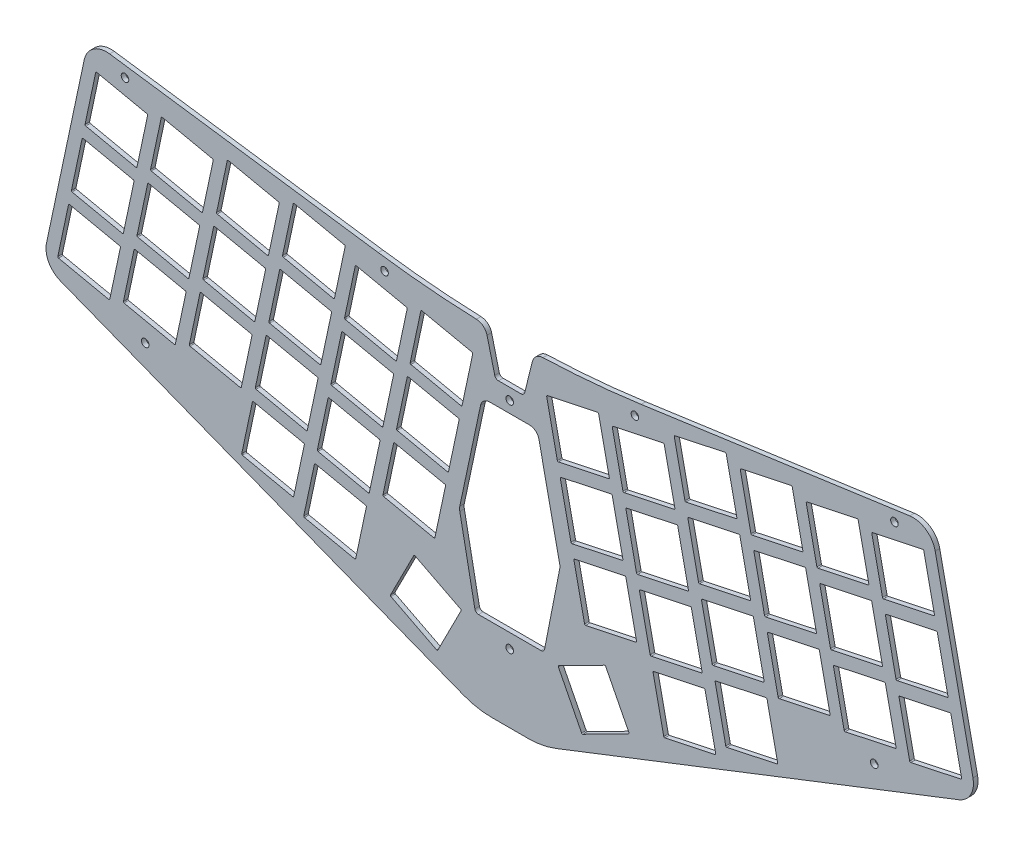
from build123d import *

# Parameters (mm, degrees)
MODEL_R             = 1
BOSS_EXTRUDE1_DEPTH = 1.2


with BuildPart() as part:
    # Model → Boss-Extrude1 (new body)
    with BuildSketch(Plane.XY):
        with BuildLine():
            ThreePointArc((119.338629114, -36.3417418), (123.033383047, -35.997499058), (126.600947758, -34.976621137))
            Line((126.600947758, -34.976621137), (232.915297986, 6.455827865))
            ThreePointArc((232.915297986, 6.455827865), (236.0167753, 9.19676994), (236.605487998, 13.293761806))
            Line((236.605487998, 13.293761806), (226.655780482, 60.103455566))
            ThreePointArc((226.655780482, 60.103455566), (224.228353496, 63.77089769), (219.95185627, 64.797593838))
            Line((219.95185627, 64.797593838), (149.130188739, 54.844257568))
            ThreePointArc((149.130188739, 54.844257568), (136.222632248, 53.372447422), (123.255880075, 52.575843528))
            ThreePointArc((123.255880075, 52.575843528), (121.473278822, 51.908806158), (120.45077354, 50.303474719))
            Line((120.45077354, 50.303474719), (118.425135625, 42.179084789))
            ThreePointArc((118.425135625, 42.179084789), (118.070501374, 41.632995931), (117.454839898, 41.421006685))
            Line((117.454839898, 41.421006685), (111.497333302, 41.421006685))
            ThreePointArc((111.497333302, 41.421006685), (110.881671826, 41.632995931), (110.527037575, 42.179084789))
            Line((110.527037575, 42.179084789), (108.50139966, 50.303474719))
            ThreePointArc((108.50139966, 50.303474719), (107.478894378, 51.908806158), (105.696293125, 52.575843528))
            ThreePointArc((105.696293125, 52.575843528), (92.729540952, 53.372447422), (79.821984461, 54.844257568))
            Line((79.821984461, 54.844257568), (9.00031693, 64.797593838))
            ThreePointArc((9.00031693, 64.797593838), (4.723819704, 63.77089769), (2.296392718, 60.103455566))
            Line((2.296392718, 60.103455566), (-7.653314798, 13.293761806))
            ThreePointArc((-7.653314798, 13.293761806), (-7.0646021, 9.19676994), (-3.963124786, 6.455827865))
            Line((-3.963124786, 6.455827865), (102.351225442, -34.976621137))
            ThreePointArc((102.351225442, -34.976621137), (105.918790153, -35.997499058), (109.613544086, -36.3417418))
            Line((109.613544086, -36.3417418), (119.338629114, -36.3417418))
        make_face()
        with BuildLine():
            Line((89.509984524, -9.560584668), (101.538572624, -15.689456368))
            ThreePointArc((101.538572624, -15.689456368), (101.662839129, -15.83495375), (101.647826632, -16.025705624))
            Line((101.647826632, -16.025705624), (95.518954932, -28.054293724))
            ThreePointArc((95.518954932, -28.054293724), (95.37345755, -28.178560229), (95.182705676, -28.163547732))
            Line((95.182705676, -28.163547732), (83.154117576, -22.034676032))
            ThreePointArc((83.154117576, -22.034676032), (83.029851071, -21.88917865), (83.044863568, -21.698426776))
            Line((83.044863568, -21.698426776), (89.173735268, -9.669838676))
            ThreePointArc((89.173735268, -9.669838676), (89.31923265, -9.545572171), (89.509984524, -9.560584668))
        make_face(mode=Mode.SUBTRACT)
        with BuildLine():
            Line((46.927405722, 4.338040313), (60.132398335, 1.5312325))
            ThreePointArc((60.132398335, 1.5312325), (60.290088055, 1.422855359), (60.324957313, 1.234717678))
            Line((60.324957313, 1.234717678), (57.5181495, -11.970274935))
            ThreePointArc((57.5181495, -11.970274935), (57.409772359, -12.127964655), (57.221634678, -12.162833913))
            Line((57.221634678, -12.162833913), (44.016642065, -9.3560261))
            ThreePointArc((44.016642065, -9.3560261), (43.858952345, -9.247648959), (43.824083087, -9.059511278))
            Line((43.824083087, -9.059511278), (46.6308909, 4.145481335))
            ThreePointArc((46.6308909, 4.145481335), (46.739268041, 4.303171055), (46.927405722, 4.338040313))
        make_face(mode=Mode.SUBTRACT)
        with Locations((18.380405922, 3.505093389)):
            Circle(MODEL_R, mode=Mode.SUBTRACT)
        with BuildLine():
            ThreePointArc((46.326049635, 19.5453863), (46.483739355, 19.437009159), (46.518608613, 19.248871478))
            Line((46.518608613, 19.248871478), (43.7118008, 6.043878865))
            ThreePointArc((43.7118008, 6.043878865), (43.603423659, 5.886189145), (43.415285978, 5.851319887))
            Line((43.415285978, 5.851319887), (30.210293365, 8.6581277))
            ThreePointArc((30.210293365, 8.6581277), (30.052603645, 8.766504841), (30.017734387, 8.954642522))
            Line((30.017734387, 8.954642522), (32.8245422, 22.159635135))
            ThreePointArc((32.8245422, 22.159635135), (32.932919341, 22.317324855), (33.121057022, 22.352194113))
            Line((33.121057022, 22.352194113), (46.326049635, 19.5453863))
        make_face(mode=Mode.SUBTRACT)
        with BuildLine():
            Line((63.280672622, -1.693805387), (76.485665235, -4.5006132))
            ThreePointArc((76.485665235, -4.5006132), (76.643354955, -4.608990341), (76.678224213, -4.797128022))
            Line((76.678224213, -4.797128022), (73.8714164, -18.002120635))
            ThreePointArc((73.8714164, -18.002120635), (73.763039259, -18.159810355), (73.574901578, -18.194679613))
            Line((73.574901578, -18.194679613), (60.369908965, -15.3878718))
            ThreePointArc((60.369908965, -15.3878718), (60.212219245, -15.279494659), (60.177349987, -15.091356978))
            Line((60.177349987, -15.091356978), (62.9841578, -1.886364365))
            ThreePointArc((62.9841578, -1.886364365), (63.092534941, -1.728674645), (63.280672622, -1.693805387))
        make_face(mode=Mode.SUBTRACT)
        with BuildLine():
            Line((66.867149222, 15.179240713), (80.072141835, 12.3724329))
            ThreePointArc((80.072141835, 12.3724329), (80.229831555, 12.264055759), (80.264700813, 12.075918078))
            Line((80.264700813, 12.075918078), (77.457893, -1.129074535))
            ThreePointArc((77.457893, -1.129074535), (77.349515859, -1.286764255), (77.161378178, -1.321633513))
            Line((77.161378178, -1.321633513), (63.956385565, 1.4851743))
            ThreePointArc((63.956385565, 1.4851743), (63.798695845, 1.593551441), (63.763826587, 1.781689122))
            Line((63.763826587, 1.781689122), (66.5706344, 14.986681735))
            ThreePointArc((66.5706344, 14.986681735), (66.679011541, 15.144371455), (66.867149222, 15.179240713))
        make_face(mode=Mode.SUBTRACT)
        with BuildLine():
            Line((50.513882322, 21.211086413), (63.718874935, 18.4042786))
            ThreePointArc((63.718874935, 18.4042786), (63.876564655, 18.295901459), (63.911433913, 18.107763778))
            Line((63.911433913, 18.107763778), (61.1046261, 4.902771165))
            ThreePointArc((61.1046261, 4.902771165), (60.996248959, 4.745081445), (60.808111278, 4.710212187))
            Line((60.808111278, 4.710212187), (47.603118665, 7.51702))
            ThreePointArc((47.603118665, 7.51702), (47.445428945, 7.625397141), (47.410559687, 7.813534822))
            Line((47.410559687, 7.813534822), (50.2173675, 21.018527435))
            ThreePointArc((50.2173675, 21.018527435), (50.325744641, 21.176217155), (50.513882322, 21.211086413))
        make_face(mode=Mode.SUBTRACT)
        with BuildLine():
            Line((84.156018722, 13.549059313), (97.361011335, 10.7422515))
            ThreePointArc((97.361011335, 10.7422515), (97.518701055, 10.633874359), (97.553570313, 10.445736678))
            Line((97.553570313, 10.445736678), (94.7467625, -2.759255935))
            ThreePointArc((94.7467625, -2.759255935), (94.638385359, -2.916945655), (94.450247678, -2.951814913))
            Line((94.450247678, -2.951814913), (81.245255065, -0.1450071))
            ThreePointArc((81.245255065, -0.1450071), (81.087565345, -0.036629959), (81.052696087, 0.151507722))
            Line((81.052696087, 0.151507722), (83.8595039, 13.356500335))
            ThreePointArc((83.8595039, 13.356500335), (83.967881041, 13.514190055), (84.156018722, 13.549059313))
        make_face(mode=Mode.SUBTRACT)
        with BuildLine():
            Line((127.643452867, 6.515489672), (123.671373637, -13.757755399))
            ThreePointArc((123.671373637, -13.757755399), (123.325535014, -14.337582176), (122.690031867, -14.565483898))
            Line((122.690031867, -14.565483898), (106.262141333, -14.565483898))
            ThreePointArc((106.262141333, -14.565483898), (105.626638186, -14.337582176), (105.280799563, -13.757755399))
            Line((105.280799563, -13.757755399), (101.308720333, 6.515489672))
            ThreePointArc((101.308720333, 6.515489672), (101.252841202, 7.116248716), (101.318302841, 7.716039245))
            Line((101.318302841, 7.716039245), (106.786266514, 33.44078591))
            ThreePointArc((106.786266514, 33.44078591), (107.658334538, 34.863871588), (109.231635516, 35.421006685))
            Line((109.231635516, 35.421006685), (119.720537684, 35.421006685))
            ThreePointArc((119.720537684, 35.421006685), (121.293838662, 34.863871588), (122.165906686, 33.44078591))
            Line((122.165906686, 33.44078591), (127.633870359, 7.716039245))
            ThreePointArc((127.633870359, 7.716039245), (127.699331998, 7.116248716), (127.643452867, 6.515489672))
        make_face(mode=Mode.SUBTRACT)
        with Locations((114.4760866, -18.3417418)):
            Circle(MODEL_R, mode=Mode.SUBTRACT)
        with BuildLine():
            Line((127.413600576, -15.689456368), (139.442188676, -9.560584668))
            ThreePointArc((139.442188676, -9.560584668), (139.63294055, -9.545572171), (139.778437932, -9.669838676))
            Line((139.778437932, -9.669838676), (145.907309632, -21.698426776))
            ThreePointArc((145.907309632, -21.698426776), (145.922322129, -21.88917865), (145.798055624, -22.034676032))
            Line((145.798055624, -22.034676032), (133.769467524, -28.163547732))
            ThreePointArc((133.769467524, -28.163547732), (133.57871565, -28.178560229), (133.433218268, -28.054293724))
            Line((133.433218268, -28.054293724), (127.304346568, -16.025705624))
            ThreePointArc((127.304346568, -16.025705624), (127.289334071, -15.83495375), (127.413600576, -15.689456368))
        make_face(mode=Mode.SUBTRACT)
        with BuildLine():
            Line((152.466507965, -4.5006132), (165.671500578, -1.693805387))
            ThreePointArc((165.671500578, -1.693805387), (165.859638259, -1.728674645), (165.9680154, -1.886364365))
            Line((165.9680154, -1.886364365), (168.774823213, -15.091356978))
            ThreePointArc((168.774823213, -15.091356978), (168.739953955, -15.279494659), (168.582264235, -15.3878718))
            Line((168.582264235, -15.3878718), (155.377271622, -18.194679613))
            ThreePointArc((155.377271622, -18.194679613), (155.189133941, -18.159810355), (155.0807568, -18.002120635))
            Line((155.0807568, -18.002120635), (152.273948987, -4.797128022))
            ThreePointArc((152.273948987, -4.797128022), (152.308818245, -4.608990341), (152.466507965, -4.5006132))
        make_face(mode=Mode.SUBTRACT)
        with BuildLine():
            Line((131.591161865, 10.7422515), (144.796154478, 13.549059313))
            ThreePointArc((144.796154478, 13.549059313), (144.984292159, 13.514190055), (145.0926693, 13.356500335))
            Line((145.0926693, 13.356500335), (147.899477113, 0.151507722))
            ThreePointArc((147.899477113, 0.151507722), (147.864607855, -0.036629959), (147.706918135, -0.1450071))
            Line((147.706918135, -0.1450071), (134.501925522, -2.951814913))
            ThreePointArc((134.501925522, -2.951814913), (134.313787841, -2.916945655), (134.2054107, -2.759255935))
            Line((134.2054107, -2.759255935), (131.398602887, 10.445736678))
            ThreePointArc((131.398602887, 10.445736678), (131.433472145, 10.633874359), (131.591161865, 10.7422515))
        make_face(mode=Mode.SUBTRACT)
        with BuildLine():
            Line((148.880031365, 12.3724329), (162.085023978, 15.179240713))
            ThreePointArc((162.085023978, 15.179240713), (162.273161659, 15.144371455), (162.3815388, 14.986681735))
            Line((162.3815388, 14.986681735), (165.188346613, 1.781689122))
            ThreePointArc((165.188346613, 1.781689122), (165.153477355, 1.593551441), (164.995787635, 1.4851743))
            Line((164.995787635, 1.4851743), (151.790795022, -1.321633513))
            ThreePointArc((151.790795022, -1.321633513), (151.602657341, -1.286764255), (151.4942802, -1.129074535))
            Line((151.4942802, -1.129074535), (148.687472387, 12.075918078))
            ThreePointArc((148.687472387, 12.075918078), (148.722341645, 12.264055759), (148.880031365, 12.3724329))
        make_face(mode=Mode.SUBTRACT)
        with BuildLine():
            Line((165.233298265, 18.4042786), (178.438290878, 21.211086413))
            ThreePointArc((178.438290878, 21.211086413), (178.626428559, 21.176217155), (178.7348057, 21.018527435))
            Line((178.7348057, 21.018527435), (181.541613513, 7.813534822))
            ThreePointArc((181.541613513, 7.813534822), (181.506744255, 7.625397141), (181.349054535, 7.51702))
            Line((181.349054535, 7.51702), (168.144061922, 4.710212187))
            ThreePointArc((168.144061922, 4.710212187), (167.955924241, 4.745081445), (167.8475471, 4.902771165))
            Line((167.8475471, 4.902771165), (165.040739287, 18.107763778))
            ThreePointArc((165.040739287, 18.107763778), (165.075608545, 18.295901459), (165.233298265, 18.4042786))
        make_face(mode=Mode.SUBTRACT)
        with BuildLine():
            Line((168.819774865, 1.5312325), (182.024767478, 4.338040313))
            ThreePointArc((182.024767478, 4.338040313), (182.212905159, 4.303171055), (182.3212823, 4.145481335))
            Line((182.3212823, 4.145481335), (185.128090113, -9.059511278))
            ThreePointArc((185.128090113, -9.059511278), (185.093220855, -9.247648959), (184.935531135, -9.3560261))
            Line((184.935531135, -9.3560261), (171.730538522, -12.162833913))
            ThreePointArc((171.730538522, -12.162833913), (171.542400841, -12.127964655), (171.4340237, -11.970274935))
            Line((171.4340237, -11.970274935), (168.627215887, 1.234717678))
            ThreePointArc((168.627215887, 1.234717678), (168.662085145, 1.422855359), (168.819774865, 1.5312325))
        make_face(mode=Mode.SUBTRACT)
        with BuildLine():
            Line((182.626123565, 19.5453863), (195.831116178, 22.352194113))
            ThreePointArc((195.831116178, 22.352194113), (196.019253859, 22.317324855), (196.127631, 22.159635135))
            Line((196.127631, 22.159635135), (198.934438813, 8.954642522))
            ThreePointArc((198.934438813, 8.954642522), (198.899569555, 8.766504841), (198.741879835, 8.6581277))
            Line((198.741879835, 8.6581277), (185.536887222, 5.851319887))
            ThreePointArc((185.536887222, 5.851319887), (185.348749541, 5.886189145), (185.2403724, 6.043878865))
            Line((185.2403724, 6.043878865), (182.433564587, 19.248871478))
            ThreePointArc((182.433564587, 19.248871478), (182.468433845, 19.437009159), (182.626123565, 19.5453863))
        make_face(mode=Mode.SUBTRACT)
        with Locations((210.571767278, 3.505093389)):
            Circle(MODEL_R, mode=Mode.SUBTRACT)
        with BuildLine():
            ThreePointArc((-4.471401435, 11.4294168), (-4.629091155, 11.537793941), (-4.663960413, 11.725931622))
            Line((-4.663960413, 11.725931622), (-1.8571526, 24.930924235))
            ThreePointArc((-1.8571526, 24.930924235), (-1.748775459, 25.088613955), (-1.560637778, 25.123483213))
            Line((-1.560637778, 25.123483213), (11.644354835, 22.3166754))
            ThreePointArc((11.644354835, 22.3166754), (11.802044555, 22.208298259), (11.836913813, 22.020160578))
            Line((11.836913813, 22.020160578), (9.030106, 8.815167965))
            ThreePointArc((9.030106, 8.815167965), (8.921728859, 8.657478245), (8.733591178, 8.622608987))
            Line((8.733591178, 8.622608987), (-4.471401435, 11.4294168))
        make_face(mode=Mode.SUBTRACT)
        with BuildLine():
            ThreePointArc((28.933224335, 20.6864939), (29.090914055, 20.578116759), (29.125783313, 20.389979078))
            Line((29.125783313, 20.389979078), (26.3189755, 7.184986465))
            ThreePointArc((26.3189755, 7.184986465), (26.210598359, 7.027296745), (26.022460678, 6.992427487))
            Line((26.022460678, 6.992427487), (12.817468065, 9.7992353))
            ThreePointArc((12.817468065, 9.7992353), (12.659778345, 9.907612441), (12.624909087, 10.095750122))
            Line((12.624909087, 10.095750122), (15.4317169, 23.300742735))
            ThreePointArc((15.4317169, 23.300742735), (15.540094041, 23.458432455), (15.728231722, 23.493301713))
            Line((15.728231722, 23.493301713), (28.933224335, 20.6864939))
        make_face(mode=Mode.SUBTRACT)
        with BuildLine():
            ThreePointArc((15.230831435, 39.1897215), (15.388521155, 39.081344359), (15.423390413, 38.893206678))
            Line((15.423390413, 38.893206678), (12.6165826, 25.688214065))
            ThreePointArc((12.6165826, 25.688214065), (12.508205459, 25.530524345), (12.320067778, 25.495655087))
            Line((12.320067778, 25.495655087), (-0.884924835, 28.3024629))
            ThreePointArc((-0.884924835, 28.3024629), (-1.042614555, 28.410840041), (-1.077483813, 28.598977722))
            Line((-1.077483813, 28.598977722), (1.729324, 41.803970335))
            ThreePointArc((1.729324, 41.803970335), (1.837701141, 41.961660055), (2.025838822, 41.996529313))
            Line((2.025838822, 41.996529313), (15.230831435, 39.1897215))
        make_face(mode=Mode.SUBTRACT)
        with BuildLine():
            ThreePointArc((32.519700935, 37.5595401), (32.677390655, 37.451162959), (32.712259913, 37.263025278))
            Line((32.712259913, 37.263025278), (29.9054521, 24.058032665))
            ThreePointArc((29.9054521, 24.058032665), (29.797074959, 23.900342945), (29.608937278, 23.865473687))
            Line((29.608937278, 23.865473687), (16.403944665, 26.6722815))
            ThreePointArc((16.403944665, 26.6722815), (16.246254945, 26.780658641), (16.211385687, 26.968796322))
            Line((16.211385687, 26.968796322), (19.0181935, 40.173788935))
            ThreePointArc((19.0181935, 40.173788935), (19.126570641, 40.331478655), (19.314708322, 40.366347913))
            Line((19.314708322, 40.366347913), (32.519700935, 37.5595401))
        make_face(mode=Mode.SUBTRACT)
        with BuildLine():
            ThreePointArc((49.912526335, 36.4184324), (50.070216055, 36.310055259), (50.105085313, 36.121917578))
            Line((50.105085313, 36.121917578), (47.2982775, 22.916924965))
            ThreePointArc((47.2982775, 22.916924965), (47.189900359, 22.759235245), (47.001762678, 22.724365987))
            Line((47.001762678, 22.724365987), (33.796770065, 25.5311738))
            ThreePointArc((33.796770065, 25.5311738), (33.639080345, 25.639550941), (33.604211087, 25.827688622))
            Line((33.604211087, 25.827688622), (36.4110189, 39.032681235))
            ThreePointArc((36.4110189, 39.032681235), (36.519396041, 39.190370955), (36.707533722, 39.225240213))
            Line((36.707533722, 39.225240213), (49.912526335, 36.4184324))
        make_face(mode=Mode.SUBTRACT)
        with BuildLine():
            Line((70.453625922, 32.052286913), (83.658618535, 29.2454791))
            ThreePointArc((83.658618535, 29.2454791), (83.816308255, 29.137101959), (83.851177513, 28.948964278))
            Line((83.851177513, 28.948964278), (81.0443697, 15.743971665))
            ThreePointArc((81.0443697, 15.743971665), (80.935992559, 15.586281945), (80.747854878, 15.551412687))
            Line((80.747854878, 15.551412687), (67.542862265, 18.3582205))
            ThreePointArc((67.542862265, 18.3582205), (67.385172545, 18.466597641), (67.350303287, 18.654735322))
            Line((67.350303287, 18.654735322), (70.1571111, 31.859727935))
            ThreePointArc((70.1571111, 31.859727935), (70.265488241, 32.017417655), (70.453625922, 32.052286913))
        make_face(mode=Mode.SUBTRACT)
        with BuildLine():
            Line((87.742495422, 30.422105413), (100.947488035, 27.6152976))
            ThreePointArc((100.947488035, 27.6152976), (101.105177755, 27.506920459), (101.140047013, 27.318782778))
            Line((101.140047013, 27.318782778), (98.3332392, 14.113790165))
            ThreePointArc((98.3332392, 14.113790165), (98.224862059, 13.956100445), (98.036724378, 13.921231187))
            Line((98.036724378, 13.921231187), (84.831731765, 16.728039))
            ThreePointArc((84.831731765, 16.728039), (84.674042045, 16.836416141), (84.639172787, 17.024553822))
            Line((84.639172787, 17.024553822), (87.4459806, 30.229546435))
            ThreePointArc((87.4459806, 30.229546435), (87.554357741, 30.387236155), (87.742495422, 30.422105413))
        make_face(mode=Mode.SUBTRACT)
        with BuildLine():
            Line((54.100359022, 38.084132513), (67.305351635, 35.2773247))
            ThreePointArc((67.305351635, 35.2773247), (67.463041355, 35.168947559), (67.497910613, 34.980809878))
            Line((67.497910613, 34.980809878), (64.6911028, 21.775817265))
            ThreePointArc((64.6911028, 21.775817265), (64.582725659, 21.618127545), (64.394587978, 21.583258287))
            Line((64.394587978, 21.583258287), (51.189595365, 24.3900661))
            ThreePointArc((51.189595365, 24.3900661), (51.031905645, 24.498443241), (50.997036387, 24.686580922))
            Line((50.997036387, 24.686580922), (53.8038442, 37.891573535))
            ThreePointArc((53.8038442, 37.891573535), (53.912221341, 38.049263255), (54.100359022, 38.084132513))
        make_face(mode=Mode.SUBTRACT)
        with BuildLine():
            Line((91.328972122, 47.295151513), (104.533964735, 44.4883437))
            ThreePointArc((104.533964735, 44.4883437), (104.691654455, 44.379966559), (104.726523713, 44.191828878))
            Line((104.726523713, 44.191828878), (101.9197159, 30.986836265))
            ThreePointArc((101.9197159, 30.986836265), (101.811338759, 30.829146545), (101.623201078, 30.794277287))
            Line((101.623201078, 30.794277287), (88.418208465, 33.6010851))
            ThreePointArc((88.418208465, 33.6010851), (88.260518745, 33.709462241), (88.225649487, 33.897599922))
            Line((88.225649487, 33.897599922), (91.0324573, 47.102592535))
            ThreePointArc((91.0324573, 47.102592535), (91.140834441, 47.260282255), (91.328972122, 47.295151513))
        make_face(mode=Mode.SUBTRACT)
        with BuildLine():
            ThreePointArc((2.701551865, 45.175509), (2.543862145, 45.283886141), (2.508992887, 45.472023822))
            Line((2.508992887, 45.472023822), (5.3158007, 58.677016435))
            ThreePointArc((5.3158007, 58.677016435), (5.424177841, 58.834706155), (5.612315522, 58.869575413))
            Line((5.612315522, 58.869575413), (18.817308135, 56.0627676))
            ThreePointArc((18.817308135, 56.0627676), (18.974997855, 55.954390459), (19.009867113, 55.766252778))
            Line((19.009867113, 55.766252778), (16.2030593, 42.561260165))
            ThreePointArc((16.2030593, 42.561260165), (16.094682159, 42.403570445), (15.906544478, 42.368701187))
            Line((15.906544478, 42.368701187), (2.701551865, 45.175509))
        make_face(mode=Mode.SUBTRACT)
        with BuildLine():
            ThreePointArc((19.990421365, 43.5453276), (19.832731645, 43.653704741), (19.797862387, 43.841842422))
            Line((19.797862387, 43.841842422), (22.6046702, 57.046835035))
            ThreePointArc((22.6046702, 57.046835035), (22.713047341, 57.204524755), (22.901185022, 57.239394013))
            Line((22.901185022, 57.239394013), (36.106177635, 54.4325862))
            ThreePointArc((36.106177635, 54.4325862), (36.263867355, 54.324209059), (36.298736613, 54.136071378))
            Line((36.298736613, 54.136071378), (33.4919288, 40.931078765))
            ThreePointArc((33.4919288, 40.931078765), (33.383551659, 40.773389045), (33.195413978, 40.738519787))
            Line((33.195413978, 40.738519787), (19.990421365, 43.5453276))
        make_face(mode=Mode.SUBTRACT)
        with BuildLine():
            ThreePointArc((53.499002935, 53.2914785), (53.656692655, 53.183101359), (53.691561913, 52.994963678))
            Line((53.691561913, 52.994963678), (50.8847541, 39.789971065))
            ThreePointArc((50.8847541, 39.789971065), (50.776376959, 39.632281345), (50.588239278, 39.597412087))
            Line((50.588239278, 39.597412087), (37.383246665, 42.4042199))
            ThreePointArc((37.383246665, 42.4042199), (37.225556945, 42.512597041), (37.190687687, 42.700734722))
            Line((37.190687687, 42.700734722), (39.9974955, 55.905727335))
            ThreePointArc((39.9974955, 55.905727335), (40.105872641, 56.063417055), (40.294010322, 56.098286313))
            Line((40.294010322, 56.098286313), (53.499002935, 53.2914785))
        make_face(mode=Mode.SUBTRACT)
        with Locations((13.046458588, 61.37876191)):
            Circle(MODEL_R, mode=Mode.SUBTRACT)
        with BuildLine():
            Line((74.040102622, 48.925333013), (87.245095235, 46.1185252))
            ThreePointArc((87.245095235, 46.1185252), (87.402784955, 46.010148059), (87.437654213, 45.822010378))
            Line((87.437654213, 45.822010378), (84.6308464, 32.617017765))
            ThreePointArc((84.6308464, 32.617017765), (84.522469259, 32.459328045), (84.334331578, 32.424458787))
            Line((84.334331578, 32.424458787), (71.129338965, 35.2312666))
            ThreePointArc((71.129338965, 35.2312666), (70.971649245, 35.339643741), (70.936779987, 35.527781422))
            Line((70.936779987, 35.527781422), (73.7435878, 48.732774035))
            ThreePointArc((73.7435878, 48.732774035), (73.851964941, 48.890463755), (74.040102622, 48.925333013))
        make_face(mode=Mode.SUBTRACT)
        with BuildLine():
            Line((57.686835722, 54.957178613), (70.891828335, 52.1503708))
            ThreePointArc((70.891828335, 52.1503708), (71.049518055, 52.041993659), (71.084387313, 51.853855978))
            Line((71.084387313, 51.853855978), (68.2775795, 38.648863365))
            ThreePointArc((68.2775795, 38.648863365), (68.169202359, 38.491173645), (67.981064678, 38.456304387))
            Line((67.981064678, 38.456304387), (54.776072065, 41.2631122))
            ThreePointArc((54.776072065, 41.2631122), (54.618382345, 41.371489341), (54.583513087, 41.559627022))
            Line((54.583513087, 41.559627022), (57.3903209, 54.764619635))
            ThreePointArc((57.3903209, 54.764619635), (57.498698041, 54.922309355), (57.686835722, 54.957178613))
        make_face(mode=Mode.SUBTRACT)
        with Locations((81.474245688, 51.43451951)):
            Circle(MODEL_R, mode=Mode.SUBTRACT)
        with BuildLine():
            Line((128.004685165, 27.6152976), (141.209677778, 30.422105413))
            ThreePointArc((141.209677778, 30.422105413), (141.397815459, 30.387236155), (141.5061926, 30.229546435))
            Line((141.5061926, 30.229546435), (144.313000413, 17.024553822))
            ThreePointArc((144.313000413, 17.024553822), (144.278131155, 16.836416141), (144.120441435, 16.728039))
            Line((144.120441435, 16.728039), (130.915448822, 13.921231187))
            ThreePointArc((130.915448822, 13.921231187), (130.727311141, 13.956100445), (130.618934, 14.113790165))
            Line((130.618934, 14.113790165), (127.812126187, 27.318782778))
            ThreePointArc((127.812126187, 27.318782778), (127.846995445, 27.506920459), (128.004685165, 27.6152976))
        make_face(mode=Mode.SUBTRACT)
        with BuildLine():
            Line((145.293554665, 29.2454791), (158.498547278, 32.052286913))
            ThreePointArc((158.498547278, 32.052286913), (158.686684959, 32.017417655), (158.7950621, 31.859727935))
            Line((158.7950621, 31.859727935), (161.601869913, 18.654735322))
            ThreePointArc((161.601869913, 18.654735322), (161.567000655, 18.466597641), (161.409310935, 18.3582205))
            Line((161.409310935, 18.3582205), (148.204318322, 15.551412687))
            ThreePointArc((148.204318322, 15.551412687), (148.016180641, 15.586281945), (147.9078035, 15.743971665))
            Line((147.9078035, 15.743971665), (145.100995687, 28.948964278))
            ThreePointArc((145.100995687, 28.948964278), (145.135864945, 29.137101959), (145.293554665, 29.2454791))
        make_face(mode=Mode.SUBTRACT)
        with Locations((114.4760866, 38.421006685)):
            Circle(MODEL_R, mode=Mode.SUBTRACT)
        with BuildLine():
            Line((124.418208465, 44.4883437), (137.623201078, 47.295151513))
            ThreePointArc((137.623201078, 47.295151513), (137.811338759, 47.260282255), (137.9197159, 47.102592535))
            Line((137.9197159, 47.102592535), (140.726523713, 33.897599922))
            ThreePointArc((140.726523713, 33.897599922), (140.691654455, 33.709462241), (140.533964735, 33.6010851))
            Line((140.533964735, 33.6010851), (127.328972122, 30.794277287))
            ThreePointArc((127.328972122, 30.794277287), (127.140834441, 30.829146545), (127.0324573, 30.986836265))
            Line((127.0324573, 30.986836265), (124.225649487, 44.191828878))
            ThreePointArc((124.225649487, 44.191828878), (124.260518745, 44.379966559), (124.418208465, 44.4883437))
        make_face(mode=Mode.SUBTRACT)
        with BuildLine():
            Line((161.646821565, 35.2773247), (174.851814178, 38.084132513))
            ThreePointArc((174.851814178, 38.084132513), (175.039951859, 38.049263255), (175.148329, 37.891573535))
            Line((175.148329, 37.891573535), (177.955136813, 24.686580922))
            ThreePointArc((177.955136813, 24.686580922), (177.920267555, 24.498443241), (177.762577835, 24.3900661))
            Line((177.762577835, 24.3900661), (164.557585222, 21.583258287))
            ThreePointArc((164.557585222, 21.583258287), (164.369447541, 21.618127545), (164.2610704, 21.775817265))
            Line((164.2610704, 21.775817265), (161.454262587, 34.980809878))
            ThreePointArc((161.454262587, 34.980809878), (161.489131845, 35.168947559), (161.646821565, 35.2773247))
        make_face(mode=Mode.SUBTRACT)
        with BuildLine():
            Line((200.018948865, 20.6864939), (213.223941478, 23.493301713))
            ThreePointArc((213.223941478, 23.493301713), (213.412079159, 23.458432455), (213.5204563, 23.300742735))
            Line((213.5204563, 23.300742735), (216.327264113, 10.095750122))
            ThreePointArc((216.327264113, 10.095750122), (216.292394855, 9.907612441), (216.134705135, 9.7992353))
            Line((216.134705135, 9.7992353), (202.929712522, 6.992427487))
            ThreePointArc((202.929712522, 6.992427487), (202.741574841, 7.027296745), (202.6331977, 7.184986465))
            Line((202.6331977, 7.184986465), (199.826389887, 20.389979078))
            ThreePointArc((199.826389887, 20.389979078), (199.861259145, 20.578116759), (200.018948865, 20.6864939))
        make_face(mode=Mode.SUBTRACT)
        with BuildLine():
            Line((217.307818365, 22.3166754), (230.512810978, 25.123483213))
            ThreePointArc((230.512810978, 25.123483213), (230.700948659, 25.088613955), (230.8093258, 24.930924235))
            Line((230.8093258, 24.930924235), (233.616133613, 11.725931622))
            ThreePointArc((233.616133613, 11.725931622), (233.581264355, 11.537793941), (233.423574635, 11.4294168))
            Line((233.423574635, 11.4294168), (220.218582022, 8.622608987))
            ThreePointArc((220.218582022, 8.622608987), (220.030444341, 8.657478245), (219.9220672, 8.815167965))
            Line((219.9220672, 8.815167965), (217.115259387, 22.020160578))
            ThreePointArc((217.115259387, 22.020160578), (217.150128645, 22.208298259), (217.307818365, 22.3166754))
        make_face(mode=Mode.SUBTRACT)
        with BuildLine():
            Line((179.039646865, 36.4184324), (192.244639478, 39.225240213))
            ThreePointArc((192.244639478, 39.225240213), (192.432777159, 39.190370955), (192.5411543, 39.032681235))
            Line((192.5411543, 39.032681235), (195.347962113, 25.827688622))
            ThreePointArc((195.347962113, 25.827688622), (195.313092855, 25.639550941), (195.155403135, 25.5311738))
            Line((195.155403135, 25.5311738), (181.950410522, 22.724365987))
            ThreePointArc((181.950410522, 22.724365987), (181.762272841, 22.759235245), (181.6538957, 22.916924965))
            Line((181.6538957, 22.916924965), (178.847087887, 36.121917578))
            ThreePointArc((178.847087887, 36.121917578), (178.881957145, 36.310055259), (179.039646865, 36.4184324))
        make_face(mode=Mode.SUBTRACT)
        with BuildLine():
            Line((196.432472265, 37.5595401), (209.637464878, 40.366347913))
            ThreePointArc((209.637464878, 40.366347913), (209.825602559, 40.331478655), (209.9339797, 40.173788935))
            Line((209.9339797, 40.173788935), (212.740787513, 26.968796322))
            ThreePointArc((212.740787513, 26.968796322), (212.705918255, 26.780658641), (212.548228535, 26.6722815))
            Line((212.548228535, 26.6722815), (199.343235922, 23.865473687))
            ThreePointArc((199.343235922, 23.865473687), (199.155098241, 23.900342945), (199.0467211, 24.058032665))
            Line((199.0467211, 24.058032665), (196.239913287, 37.263025278))
            ThreePointArc((196.239913287, 37.263025278), (196.274782545, 37.451162959), (196.432472265, 37.5595401))
        make_face(mode=Mode.SUBTRACT)
        with BuildLine():
            Line((213.721341765, 39.1897215), (226.926334378, 41.996529313))
            ThreePointArc((226.926334378, 41.996529313), (227.114472059, 41.961660055), (227.2228492, 41.803970335))
            Line((227.2228492, 41.803970335), (230.029657013, 28.598977722))
            ThreePointArc((230.029657013, 28.598977722), (229.994787755, 28.410840041), (229.837098035, 28.3024629))
            Line((229.837098035, 28.3024629), (216.632105422, 25.495655087))
            ThreePointArc((216.632105422, 25.495655087), (216.443967741, 25.530524345), (216.3355906, 25.688214065))
            Line((216.3355906, 25.688214065), (213.528782787, 38.893206678))
            ThreePointArc((213.528782787, 38.893206678), (213.563652045, 39.081344359), (213.721341765, 39.1897215))
        make_face(mode=Mode.SUBTRACT)
        with BuildLine():
            Line((141.707077965, 46.1185252), (154.912070578, 48.925333013))
            ThreePointArc((154.912070578, 48.925333013), (155.100208259, 48.890463755), (155.2085854, 48.732774035))
            Line((155.2085854, 48.732774035), (158.015393213, 35.527781422))
            ThreePointArc((158.015393213, 35.527781422), (157.980523955, 35.339643741), (157.822834235, 35.2312666))
            Line((157.822834235, 35.2312666), (144.617841622, 32.424458787))
            ThreePointArc((144.617841622, 32.424458787), (144.429703941, 32.459328045), (144.3213268, 32.617017765))
            Line((144.3213268, 32.617017765), (141.514518987, 45.822010378))
            ThreePointArc((141.514518987, 45.822010378), (141.549388245, 46.010148059), (141.707077965, 46.1185252))
        make_face(mode=Mode.SUBTRACT)
        with Locations((147.477927512, 51.43451951)):
            Circle(MODEL_R, mode=Mode.SUBTRACT)
        with BuildLine():
            Line((158.060344865, 52.1503708), (171.265337478, 54.957178613))
            ThreePointArc((171.265337478, 54.957178613), (171.453475159, 54.922309355), (171.5618523, 54.764619635))
            Line((171.5618523, 54.764619635), (174.368660113, 41.559627022))
            ThreePointArc((174.368660113, 41.559627022), (174.333790855, 41.371489341), (174.176101135, 41.2631122))
            Line((174.176101135, 41.2631122), (160.971108522, 38.456304387))
            ThreePointArc((160.971108522, 38.456304387), (160.782970841, 38.491173645), (160.6745937, 38.648863365))
            Line((160.6745937, 38.648863365), (157.867785887, 51.853855978))
            ThreePointArc((157.867785887, 51.853855978), (157.902655145, 52.041993659), (158.060344865, 52.1503708))
        make_face(mode=Mode.SUBTRACT)
        with BuildLine():
            Line((175.453170265, 53.2914785), (188.658162878, 56.098286313))
            ThreePointArc((188.658162878, 56.098286313), (188.846300559, 56.063417055), (188.9546777, 55.905727335))
            Line((188.9546777, 55.905727335), (191.761485513, 42.700734722))
            ThreePointArc((191.761485513, 42.700734722), (191.726616255, 42.512597041), (191.568926535, 42.4042199))
            Line((191.568926535, 42.4042199), (178.363933922, 39.597412087))
            ThreePointArc((178.363933922, 39.597412087), (178.175796241, 39.632281345), (178.0674191, 39.789971065))
            Line((178.0674191, 39.789971065), (175.260611287, 52.994963678))
            ThreePointArc((175.260611287, 52.994963678), (175.295480545, 53.183101359), (175.453170265, 53.2914785))
        make_face(mode=Mode.SUBTRACT)
        with BuildLine():
            Line((192.845995565, 54.4325862), (206.050988178, 57.239394013))
            ThreePointArc((206.050988178, 57.239394013), (206.239125859, 57.204524755), (206.347503, 57.046835035))
            Line((206.347503, 57.046835035), (209.154310813, 43.841842422))
            ThreePointArc((209.154310813, 43.841842422), (209.119441555, 43.653704741), (208.961751835, 43.5453276))
            Line((208.961751835, 43.5453276), (195.756759222, 40.738519787))
            ThreePointArc((195.756759222, 40.738519787), (195.568621541, 40.773389045), (195.4602444, 40.931078765))
            Line((195.4602444, 40.931078765), (192.653436587, 54.136071378))
            ThreePointArc((192.653436587, 54.136071378), (192.688305845, 54.324209059), (192.845995565, 54.4325862))
        make_face(mode=Mode.SUBTRACT)
        with BuildLine():
            Line((210.134865065, 56.0627676), (223.339857678, 58.869575413))
            ThreePointArc((223.339857678, 58.869575413), (223.527995359, 58.834706155), (223.6363725, 58.677016435))
            Line((223.6363725, 58.677016435), (226.443180313, 45.472023822))
            ThreePointArc((226.443180313, 45.472023822), (226.408311055, 45.283886141), (226.250621335, 45.175509))
            Line((226.250621335, 45.175509), (213.045628722, 42.368701187))
            ThreePointArc((213.045628722, 42.368701187), (212.857491041, 42.403570445), (212.7491139, 42.561260165))
            Line((212.7491139, 42.561260165), (209.942306087, 55.766252778))
            ThreePointArc((209.942306087, 55.766252778), (209.977175345, 55.954390459), (210.134865065, 56.0627676))
        make_face(mode=Mode.SUBTRACT)
        with Locations((215.905714612, 61.37876191)):
            Circle(MODEL_R, mode=Mode.SUBTRACT)
    extrude(amount=BOSS_EXTRUDE1_DEPTH)


solid = part.part
